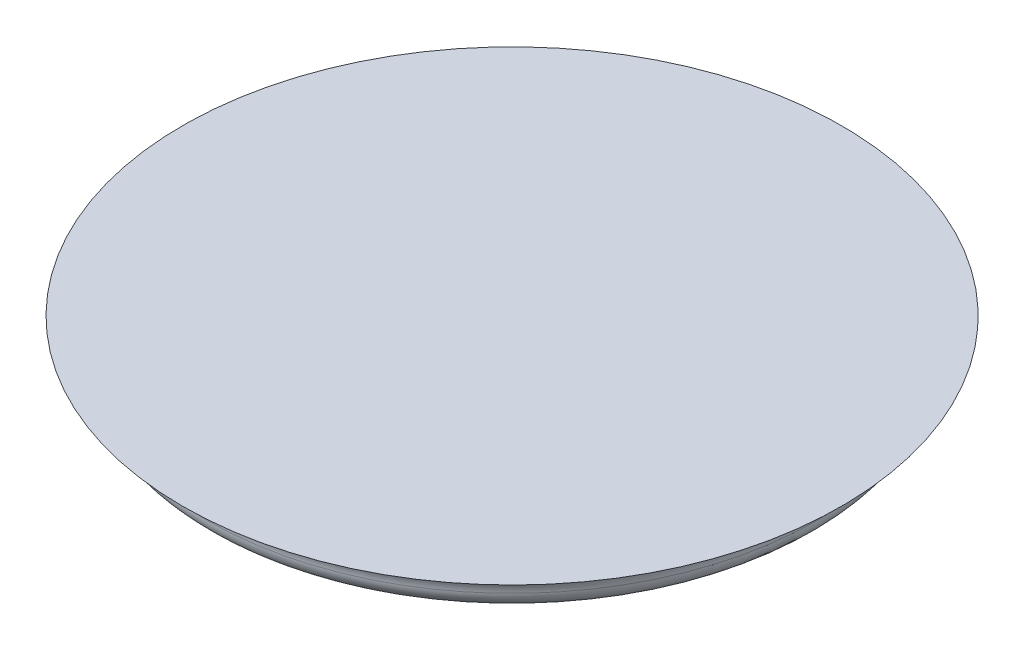
from build123d import *

# Parameters (mm, degrees)
SKETCH1_W           = 200
SKETCH1_H           = 2
BOSS_EXTRUDE1_DEPTH = 60
SKETCH2_R           = 37
BOSS_EXTRUDE2_DEPTH = 5
FILLET1_R           = 2
FILLET2_R           = 3
SKETCH4_W           = 120
SKETCH4_H           = 2
CUT_EXTRUDE1_DEPTH  = 209.865985742


with BuildPart() as part:
    # Sketch1 → Boss-Extrude1 (new, symmetric)
    with BuildSketch(Plane.XY):
        with Locations((0, 1)):
            Rectangle(SKETCH1_W, SKETCH1_H)
    extrude(amount=BOSS_EXTRUDE1_DEPTH, both=True)

    # Sketch2 → Boss-Extrude2 (add)
    with BuildSketch(Plane.XZ):
        with Locations(Location((0, 0, 0), (0, 0, 270))):
            Circle(SKETCH2_R)
    extrude(amount=BOSS_EXTRUDE2_DEPTH)

    # Fillet1
    fillet1_edges = [part.edges().sort_by_distance(p)[0] for p in [
        (0, -5, 37),
    ]]
    fillet(fillet1_edges, radius=FILLET1_R)

    # Fillet2
    fillet2_edges = [part.edges().sort_by_distance(p)[0] for p in [
        (0, 0, 37),
    ]]
    fillet(fillet2_edges, radius=FILLET2_R - 0.0001)  # a hair under: the kernel refuses the full size

    # Sketch4 → Cut-Extrude1 (cut, through all)
    with BuildSketch(Plane.ZY.offset(100)):
        with Locations((0, 1)):
            Rectangle(SKETCH4_W, SKETCH4_H)
    extrude(amount=-CUT_EXTRUDE1_DEPTH, mode=Mode.SUBTRACT)


solid = part.part
